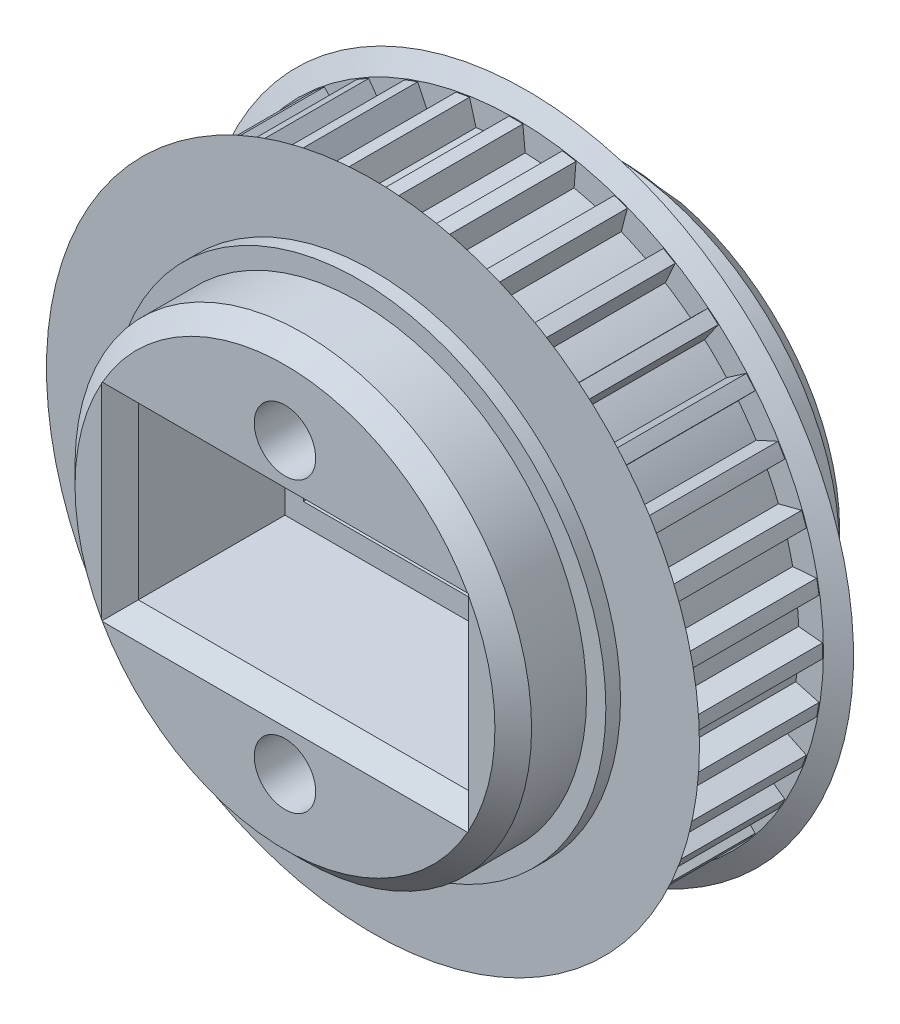
from build123d import *
from build123d.topology import SkipClean

# Parameters (mm, degrees)
CROQUIS1_R                 = 2
SALIENTE_EXTRUIR1_DEPTH    = 7.2
CROQUIS2_R                 = 18.5
CROQUIS2_R_2               = 2
SALIENTE_EXTRUIR2_DEPTH    = 0.6
SALIENTE_EXTRUIR4_START    = 6.2
CROQUIS4_R                 = 12.45
CROQUIS4_R_2               = 2
SALIENTE_EXTRUIR4_DEPTH    = 6.2
SALIENTE_EXTRUIR6_START    = 0.6
CROQUIS6_R                 = 18.5
CROQUIS6_R_2               = 2
SALIENTE_EXTRUIR6_DEPTH    = 0.6
SALIENTE_EXTRUIR5_START    = 0.6
CROQUIS5_R                 = 13.5
CROQUIS5_R_2               = 2
SALIENTE_EXTRUIR5_DEPTH    = 0.6
CHAFL_N2_SIZE              = 1.732050808
CHAFL_N2_SIZE_2            = 1
CROQUIS3_R                 = 12.45
CROQUIS3_R_2               = 2
SALIENTE_EXTRUIR7_DEPTH    = 4.8
CHAFL_N4_SIZE              = 1
CROQUIS7_R                 = 13.5
CROQUIS7_R_2               = 2
SALIENTE_EXTRUIR8_DEPTH    = 0.8
CORTAR_EXTRUIR1_DEPTH      = 29.159390904
CORTAR_EXTRUIR1_DEPTH_BACK = 29.159390904
CROQUIS8_R                 = 1.675
CROQUIS8_W                 = 16
CROQUIS8_H                 = 7
CORTAR_EXTRUIR2_DEPTH      = 5.5
REDONDEO1_R                = 2.5
CROQUIS10_W                = 18
CROQUIS10_H                = 9.3
CORTAR_EXTRUIR3_DEPTH      = 9
CHAFL_N5_SIZE              = 1


with BuildPart() as part:
    # Croquis1 → Saliente-Extruir1 (new body)
    with BuildSketch(Plane.XY):
        with BuildLine():
            Line((-0.375, 16.714216942), (-0.5, 15.410313844))
            ThreePointArc((-0.5, 15.410313844), (-1.343804123, 15.359751406), (-2.18356904, 15.263020639))
            Line((-2.18356904, 15.263020639), (-2.533090406, 16.525408497))
            ThreePointArc((-2.533090406, 16.525408497), (-2.903123715, 16.464432747), (-3.271696221, 16.395172363))
            Line((-3.271696221, 16.395172363), (-3.168376793, 15.089372461))
            ThreePointArc((-3.168376793, 15.089372461), (-3.99058156, 14.893053132), (-4.800791439, 14.651968275))
            Line((-4.800791439, 14.651968275), (-5.364214141, 15.834483876))
            ThreePointArc((-5.364214141, 15.834483876), (-5.718037486, 15.710178876), (-6.068983607, 15.577968769))
            Line((-6.068983607, 15.577968769), (-5.74048406, 14.309948132))
            ThreePointArc((-5.74048406, 14.309948132), (-6.516107195, 13.973836975), (-7.27214422, 13.595723269))
            Line((-7.27214422, 13.595723269), (-8.032348945, 14.662436476))
            ThreePointArc((-8.032348945, 14.662436476), (-8.35921158, 14.478579169), (-8.681867997, 14.287436476))
            Line((-8.681867997, 14.287436476), (-8.138169624, 13.095723269))
            ThreePointArc((-8.138169624, 13.095723269), (-8.843644211, 12.630032852), (-9.522536579, 12.126379092))
            Line((-9.522536579, 12.126379092), (-10.45642489, 13.044878363))
            ThreePointArc((-10.45642489, 13.044878363), (-10.746395261, 12.80705516), (-11.030958222, 12.562787656))
            Line((-11.030958222, 12.562787656), (-10.288581022, 11.483591482))
            ThreePointArc((-10.288581022, 11.483591482), (-10.902471572, 10.902471572), (-11.483591482, 10.288581022))
            Line((-11.483591482, 10.288581022), (-12.562787656, 11.030958222))
            ThreePointArc((-12.562787656, 11.030958222), (-12.80705516, 10.746395261), (-13.044878363, 10.45642489))
            Line((-13.044878363, 10.45642489), (-12.126379092, 9.522536579))
            ThreePointArc((-12.126379092, 9.522536579), (-12.630032852, 8.843644211), (-13.095723269, 8.138169624))
            Line((-13.095723269, 8.138169624), (-14.287436476, 8.681867997))
            ThreePointArc((-14.287436476, 8.681867997), (-14.478579169, 8.35921158), (-14.662436476, 8.032348945))
            Line((-14.662436476, 8.032348945), (-13.595723269, 7.27214422))
            ThreePointArc((-13.595723269, 7.27214422), (-13.973836975, 6.516107195), (-14.309948132, 5.74048406))
            Line((-14.309948132, 5.74048406), (-15.577968769, 6.068983607))
            ThreePointArc((-15.577968769, 6.068983607), (-15.710178876, 5.718037486), (-15.834483876, 5.364214141))
            Line((-15.834483876, 5.364214141), (-14.651968275, 4.800791439))
            ThreePointArc((-14.651968275, 4.800791439), (-14.893053132, 3.99058156), (-15.089372461, 3.168376793))
            Line((-15.089372461, 3.168376793), (-16.395172363, 3.271696221))
            ThreePointArc((-16.395172363, 3.271696221), (-16.464432747, 2.903123715), (-16.525408497, 2.533090406))
            Line((-16.525408497, 2.533090406), (-15.263020639, 2.18356904))
            ThreePointArc((-15.263020639, 2.18356904), (-15.359751406, 1.343804123), (-15.410313844, 0.5))
            Line((-15.410313844, 0.5), (-16.714216942, 0.375))
            ThreePointArc((-16.714216942, 0.375), (-16.718423161, 0), (-16.714216942, -0.375))
            Line((-16.714216942, -0.375), (-15.410313844, -0.5))
            ThreePointArc((-15.410313844, -0.5), (-15.359751406, -1.343804123), (-15.263020639, -2.18356904))
            Line((-15.263020639, -2.18356904), (-16.525408497, -2.533090406))
            ThreePointArc((-16.525408497, -2.533090406), (-16.464432747, -2.903123715), (-16.395172363, -3.271696221))
            Line((-16.395172363, -3.271696221), (-15.089372461, -3.168376793))
            ThreePointArc((-15.089372461, -3.168376793), (-14.893053132, -3.99058156), (-14.651968275, -4.800791439))
            Line((-14.651968275, -4.800791439), (-15.834483876, -5.364214141))
            ThreePointArc((-15.834483876, -5.364214141), (-15.710178876, -5.718037486), (-15.577968769, -6.068983607))
            Line((-15.577968769, -6.068983607), (-14.309948132, -5.74048406))
            ThreePointArc((-14.309948132, -5.74048406), (-13.973836975, -6.516107195), (-13.595723269, -7.27214422))
            Line((-13.595723269, -7.27214422), (-14.662436476, -8.032348945))
            ThreePointArc((-14.662436476, -8.032348945), (-14.478579169, -8.35921158), (-14.287436476, -8.681867997))
            Line((-14.287436476, -8.681867997), (-13.095723269, -8.138169624))
            ThreePointArc((-13.095723269, -8.138169624), (-12.630032852, -8.843644211), (-12.126379092, -9.522536579))
            Line((-12.126379092, -9.522536579), (-13.044878363, -10.45642489))
            ThreePointArc((-13.044878363, -10.45642489), (-12.80705516, -10.746395261), (-12.562787656, -11.030958222))
            Line((-12.562787656, -11.030958222), (-11.483591482, -10.288581022))
            ThreePointArc((-11.483591482, -10.288581022), (-10.902471572, -10.902471572), (-10.288581022, -11.483591482))
            Line((-10.288581022, -11.483591482), (-11.030958222, -12.562787656))
            ThreePointArc((-11.030958222, -12.562787656), (-10.746395261, -12.80705516), (-10.45642489, -13.044878363))
            Line((-10.45642489, -13.044878363), (-9.522536579, -12.126379092))
            ThreePointArc((-9.522536579, -12.126379092), (-8.843644211, -12.630032852), (-8.138169624, -13.095723269))
            Line((-8.138169624, -13.095723269), (-8.681867997, -14.287436476))
            ThreePointArc((-8.681867997, -14.287436476), (-8.35921158, -14.478579169), (-8.032348945, -14.662436476))
            Line((-8.032348945, -14.662436476), (-7.27214422, -13.595723269))
            ThreePointArc((-7.27214422, -13.595723269), (-6.516107195, -13.973836975), (-5.74048406, -14.309948132))
            Line((-5.74048406, -14.309948132), (-6.068983607, -15.577968769))
            ThreePointArc((-6.068983607, -15.577968769), (-5.718037486, -15.710178876), (-5.364214141, -15.834483876))
            Line((-5.364214141, -15.834483876), (-4.800791439, -14.651968275))
            ThreePointArc((-4.800791439, -14.651968275), (-3.99058156, -14.893053132), (-3.168376793, -15.089372461))
            Line((-3.168376793, -15.089372461), (-3.271696221, -16.395172363))
            ThreePointArc((-3.271696221, -16.395172363), (-2.903123715, -16.464432747), (-2.533090406, -16.525408497))
            Line((-2.533090406, -16.525408497), (-2.18356904, -15.263020639))
            ThreePointArc((-2.18356904, -15.263020639), (-1.343804123, -15.359751406), (-0.5, -15.410313844))
            Line((-0.5, -15.410313844), (-0.375, -16.714216942))
            ThreePointArc((-0.375, -16.714216942), (0, -16.718423161), (0.375, -16.714216942))
            Line((0.375, -16.714216942), (0.5, -15.410313844))
            ThreePointArc((0.5, -15.410313844), (1.343804123, -15.359751406), (2.18356904, -15.263020639))
            Line((2.18356904, -15.263020639), (2.533090406, -16.525408497))
            ThreePointArc((2.533090406, -16.525408497), (2.903123715, -16.464432747), (3.271696221, -16.395172363))
            Line((3.271696221, -16.395172363), (3.168376793, -15.089372461))
            ThreePointArc((3.168376793, -15.089372461), (3.99058156, -14.893053132), (4.800791439, -14.651968275))
            Line((4.800791439, -14.651968275), (5.364214141, -15.834483876))
            ThreePointArc((5.364214141, -15.834483876), (5.718037486, -15.710178876), (6.068983607, -15.577968769))
            Line((6.068983607, -15.577968769), (5.74048406, -14.309948132))
            ThreePointArc((5.74048406, -14.309948132), (6.516107195, -13.973836975), (7.27214422, -13.595723269))
            Line((7.27214422, -13.595723269), (8.032348945, -14.662436476))
            ThreePointArc((8.032348945, -14.662436476), (8.35921158, -14.478579169), (8.681867997, -14.287436476))
            Line((8.681867997, -14.287436476), (8.138169624, -13.095723269))
            ThreePointArc((8.138169624, -13.095723269), (8.843644211, -12.630032852), (9.522536579, -12.126379092))
            Line((9.522536579, -12.126379092), (10.45642489, -13.044878363))
            ThreePointArc((10.45642489, -13.044878363), (10.746395261, -12.80705516), (11.030958222, -12.562787656))
            Line((11.030958222, -12.562787656), (10.288581022, -11.483591482))
            ThreePointArc((10.288581022, -11.483591482), (10.902471572, -10.902471572), (11.483591482, -10.288581022))
            Line((11.483591482, -10.288581022), (12.562787656, -11.030958222))
            ThreePointArc((12.562787656, -11.030958222), (12.80705516, -10.746395261), (13.044878363, -10.45642489))
            Line((13.044878363, -10.45642489), (12.126379092, -9.522536579))
            ThreePointArc((12.126379092, -9.522536579), (12.630032852, -8.843644211), (13.095723269, -8.138169624))
            Line((13.095723269, -8.138169624), (14.287436476, -8.681867997))
            ThreePointArc((14.287436476, -8.681867997), (14.478579169, -8.35921158), (14.662436476, -8.032348945))
            Line((14.662436476, -8.032348945), (13.595723269, -7.27214422))
            ThreePointArc((13.595723269, -7.27214422), (13.973836975, -6.516107195), (14.309948132, -5.74048406))
            Line((14.309948132, -5.74048406), (15.577968769, -6.068983607))
            ThreePointArc((15.577968769, -6.068983607), (15.710178876, -5.718037486), (15.834483876, -5.364214141))
            Line((15.834483876, -5.364214141), (14.651968275, -4.800791439))
            ThreePointArc((14.651968275, -4.800791439), (14.893053132, -3.99058156), (15.089372461, -3.168376793))
            Line((15.089372461, -3.168376793), (16.395172363, -3.271696221))
            ThreePointArc((16.395172363, -3.271696221), (16.464432747, -2.903123715), (16.525408497, -2.533090406))
            Line((16.525408497, -2.533090406), (15.263020639, -2.18356904))
            ThreePointArc((15.263020639, -2.18356904), (15.359751406, -1.343804123), (15.410313844, -0.5))
            Line((15.410313844, -0.5), (16.714216942, -0.375))
            ThreePointArc((16.714216942, -0.375), (16.718423161, 0), (16.714216942, 0.375))
            Line((16.714216942, 0.375), (15.410313844, 0.5))
            ThreePointArc((15.410313844, 0.5), (15.359751406, 1.343804123), (15.263020639, 2.18356904))
            Line((15.263020639, 2.18356904), (16.525408497, 2.533090406))
            ThreePointArc((16.525408497, 2.533090406), (16.464432747, 2.903123715), (16.395172363, 3.271696221))
            Line((16.395172363, 3.271696221), (15.089372461, 3.168376793))
            ThreePointArc((15.089372461, 3.168376793), (14.893053132, 3.99058156), (14.651968275, 4.800791439))
            Line((14.651968275, 4.800791439), (15.834483876, 5.364214141))
            ThreePointArc((15.834483876, 5.364214141), (15.710178876, 5.718037486), (15.577968769, 6.068983607))
            Line((15.577968769, 6.068983607), (14.309948132, 5.74048406))
            ThreePointArc((14.309948132, 5.74048406), (13.973836975, 6.516107195), (13.595723269, 7.27214422))
            Line((13.595723269, 7.27214422), (14.662436476, 8.032348945))
            ThreePointArc((14.662436476, 8.032348945), (14.478579169, 8.35921158), (14.287436476, 8.681867997))
            Line((14.287436476, 8.681867997), (13.095723269, 8.138169624))
            ThreePointArc((13.095723269, 8.138169624), (12.630032852, 8.843644211), (12.126379092, 9.522536579))
            Line((12.126379092, 9.522536579), (13.044878363, 10.45642489))
            ThreePointArc((13.044878363, 10.45642489), (12.80705516, 10.746395261), (12.562787656, 11.030958222))
            Line((12.562787656, 11.030958222), (11.483591482, 10.288581022))
            ThreePointArc((11.483591482, 10.288581022), (10.902471572, 10.902471572), (10.288581022, 11.483591482))
            Line((10.288581022, 11.483591482), (11.030958222, 12.562787656))
            ThreePointArc((11.030958222, 12.562787656), (10.746395261, 12.80705516), (10.45642489, 13.044878363))
            Line((10.45642489, 13.044878363), (9.522536579, 12.126379092))
            ThreePointArc((9.522536579, 12.126379092), (8.843644211, 12.630032852), (8.138169624, 13.095723269))
            Line((8.138169624, 13.095723269), (8.681867997, 14.287436476))
            ThreePointArc((8.681867997, 14.287436476), (8.35921158, 14.478579169), (8.032348945, 14.662436476))
            Line((8.032348945, 14.662436476), (7.27214422, 13.595723269))
            ThreePointArc((7.27214422, 13.595723269), (6.516107195, 13.973836975), (5.74048406, 14.309948132))
            Line((5.74048406, 14.309948132), (6.068983607, 15.577968769))
            ThreePointArc((6.068983607, 15.577968769), (5.718037486, 15.710178876), (5.364214141, 15.834483876))
            Line((5.364214141, 15.834483876), (4.800791439, 14.651968275))
            ThreePointArc((4.800791439, 14.651968275), (3.99058156, 14.893053132), (3.168376793, 15.089372461))
            Line((3.168376793, 15.089372461), (3.271696221, 16.395172363))
            ThreePointArc((3.271696221, 16.395172363), (2.903123715, 16.464432747), (2.533090406, 16.525408497))
            Line((2.533090406, 16.525408497), (2.18356904, 15.263020639))
            ThreePointArc((2.18356904, 15.263020639), (1.343804123, 15.359751406), (0.5, 15.410313844))
            Line((0.5, 15.410313844), (0.375, 16.714216942))
            ThreePointArc((0.375, 16.714216942), (0, 16.718423161), (-0.375, 16.714216942))
        make_face()
        Circle(CROQUIS1_R, mode=Mode.SUBTRACT)
    extrude(amount=SALIENTE_EXTRUIR1_DEPTH)

    # Croquis2 → Saliente-Extruir2 (add)
    with BuildSketch(Plane.XY.offset(7.2)):
        Circle(CROQUIS2_R)
        Circle(CROQUIS2_R_2, mode=Mode.SUBTRACT)
    extrude(amount=SALIENTE_EXTRUIR2_DEPTH)

    # Croquis4 → Saliente-Extruir4 (add)
    with BuildSketch(Plane(origin=(0, 0, 0), x_dir=(-1, 0, 0), z_dir=(0, 0, -1)).offset(SALIENTE_EXTRUIR4_START)):
        with Locations(Location((0, 0, 0), (0, 0, 180))):
            Circle(CROQUIS4_R)
        Circle(CROQUIS4_R_2, mode=Mode.SUBTRACT)
    extrude(amount=-SALIENTE_EXTRUIR4_DEPTH)

    # Croquis6 → Saliente-Extruir6 (add)
    with SkipClean():  # the faces are left unmerged after this step: merging them gives an invalid solid
        with BuildSketch(Plane(origin=(0, 0, 0), x_dir=(-1, 0, 0), z_dir=(0, 0, -1)).offset(SALIENTE_EXTRUIR6_START)):
            with Locations(Location((0, 0, 0), (0, 0, 180))):
                Circle(CROQUIS6_R)
            Circle(CROQUIS6_R_2, mode=Mode.SUBTRACT)
        extrude(amount=-SALIENTE_EXTRUIR6_DEPTH)

    # Croquis5 → Saliente-Extruir5 (add)
    with SkipClean():  # the faces are left unmerged after this step: merging them gives an invalid solid
        with BuildSketch(Plane(origin=(0, 0, -0.6), x_dir=(-1, 0, 0), z_dir=(0, 0, -1)).offset(SALIENTE_EXTRUIR5_START)):
            Circle(CROQUIS5_R)
            Circle(CROQUIS5_R_2, mode=Mode.SUBTRACT)
        extrude(amount=-SALIENTE_EXTRUIR5_DEPTH)

    # Chaflán2
    # the kernel refuses this chamfer: 1.732050808, 1 mm, written as the material it takes off along each edge
    with BuildSketch(Plane(origin=(0, 0, 0), x_dir=(1, 0, 0), z_dir=(0, 1, 0))) as chafl_n2_piece_1:
        Polygon((18.5 - CHAFL_N2_SIZE, 0), (18.5, CHAFL_N2_SIZE_2), (18.5, 0), align=None)
    revolve(axis=Axis((0, 0, 0), (0, 0, -1)), mode=Mode.SUBTRACT)
    with BuildSketch(Plane(origin=(0, 0, 7.2), x_dir=(1, 0, 0), z_dir=(0, -1, 0))) as chafl_n2_piece_2:
        Polygon((18.5 - CHAFL_N2_SIZE, 0), (18.5, CHAFL_N2_SIZE_2), (18.5, 0), align=None)
    revolve(axis=Axis((0, 0, 7.2), (0, 0, 1)), mode=Mode.SUBTRACT)

    # Croquis3 → Saliente-Extruir7 (add)
    with BuildSketch(Plane.XY.offset(7.8)):
        Circle(CROQUIS3_R)
        with Locations(Location((0, 0, 0), (0, 0, 180))):
            Circle(CROQUIS3_R_2, mode=Mode.SUBTRACT)
    extrude(amount=SALIENTE_EXTRUIR7_DEPTH)

    # Chaflán4
    chafl_n4_edges = [part.edges().sort_by_distance(p)[0] for p in [
        (-12.45, 0, -6.2),
        (-12.45, 0, 12.6),
    ]]
    chamfer(chafl_n4_edges, length=CHAFL_N4_SIZE)

    # Croquis7 → Saliente-Extruir8 (add)
    with BuildSketch(Plane.XY.offset(7.8)):
        with Locations(Location((0, 0, 0), (0, 0, 180))):
            Circle(CROQUIS7_R)
        with Locations(Location((0, 0, 0), (0, 0, 180))):
            Circle(CROQUIS7_R_2, mode=Mode.SUBTRACT)
    extrude(amount=SALIENTE_EXTRUIR8_DEPTH)

    # Croquis8 → Cortar-Extruir1 (cut, two sides: drawn at the far end of the back side and taken through both)
    with BuildSketch(Plane.XY.offset(-CORTAR_EXTRUIR1_DEPTH_BACK)):
        with Locations((0, 7.875631857)):
            Circle(CROQUIS8_R)
        with Locations((0, -7.875631857)):
            Circle(CROQUIS8_R)
        Rectangle(CROQUIS8_W, CROQUIS8_H)
    extrude(amount=CORTAR_EXTRUIR1_DEPTH + CORTAR_EXTRUIR1_DEPTH_BACK, mode=Mode.SUBTRACT)

    # Croquis9 → Cortar-Extruir2 (cut)
    with BuildSketch(Plane(origin=(0, 0, -6.2), x_dir=(-1, 0, 0), z_dir=(0, 0, -1))):
        Polygon((2.33826859, 3.825631857), (4.67653718, 7.875631857), (2.33826859, 11.925631857), (-2.33826859, 11.925631857), (-4.67653718, 7.875631857), (-2.33826859, 3.825631857), align=None)
        Polygon((2.33826859, -11.925631857), (4.67653718, -7.875631857), (2.33826859, -3.825631857), (-2.33826859, -3.825631857), (-4.67653718, -7.875631857), (-2.33826859, -11.925631857), align=None)
    extrude(amount=-CORTAR_EXTRUIR2_DEPTH, mode=Mode.SUBTRACT)

    # Redondeo1
    redondeo1_edges = [part.edges().sort_by_distance(p)[0] for p in [
        (0, 3.825631857, -0.7),
        (3.507402885, 5.850631857, -0.7),
        (3.507402885, 9.900631857, -0.7),
        (0, 11.925631857, -0.7),
        (-3.507402885, 9.900631857, -0.7),
        (-3.507402885, 5.850631857, -0.7),
        (0, -11.925631857, -0.7),
        (3.507402885, -9.900631857, -0.7),
        (3.507402885, -5.850631857, -0.7),
        (0, -3.825631857, -0.7),
        (-3.507402885, -5.850631857, -0.7),
        (-3.507402885, -9.900631857, -0.7),
    ]]
    fillet(redondeo1_edges, radius=REDONDEO1_R)

    # Croquis10 → Cortar-Extruir3 (cut)
    with BuildSketch(Plane.XY.offset(12.6)):
        Rectangle(CROQUIS10_W, CROQUIS10_H)
    extrude(amount=-CORTAR_EXTRUIR3_DEPTH, mode=Mode.SUBTRACT)

    # Chaflán5
    # the kernel refuses this chamfer: 1 mm, written as the material it takes off along each edge
    with BuildSketch(Plane(origin=(-8, -3.5, -6.2), x_dir=(-0.9996219169112968, 0, -0.02749587661058651), z_dir=(0, 1, 0)), Plane(origin=(8, 3.5, -6.2), x_dir=(0.9996219169112968, 0, -0.02749587661058651), z_dir=(0, -1, 0))) as chafl_n5_piece_1:
        Polygon((CHAFL_N5_SIZE * 0.999621916911, CHAFL_N5_SIZE * 0.0274958766106), (-CHAFL_N5_SIZE * 0.0274958766106, CHAFL_N5_SIZE * 0.999621916911), (0, 0), align=None)
    extrude(amount=7, mode=Mode.SUBTRACT)
    with BuildSketch(Plane(origin=(-8, 3.5, -6.2), x_dir=(0, 0.9996219169112968, -0.027495876610586487), z_dir=(1, 0, 0)), Plane(origin=(8, -3.5, -6.2), x_dir=(0, -0.9996219169112968, -0.027495876610586497), z_dir=(-1, 0, 0))) as chafl_n5_piece_2:
        Polygon((CHAFL_N5_SIZE * 0.999621916911, CHAFL_N5_SIZE * 0.0274958766106), (-CHAFL_N5_SIZE * 0.0274958766106, CHAFL_N5_SIZE * 0.999621916911), (0, 0), align=None)
    extrude(amount=16, mode=Mode.SUBTRACT)
    with BuildSketch(Plane(origin=(9, -4.65, 12.6), x_dir=(0.9996219169112968, 0, 0.027495876610585647), z_dir=(0, 1, 0)), Plane(origin=(-9, 4.65, 12.6), x_dir=(-0.9996219169112968, 0, 0.027495876610585647), z_dir=(0, -1, 0))) as chafl_n5_piece_3:
        Polygon((CHAFL_N5_SIZE * 0.999621916911, CHAFL_N5_SIZE * 0.0274958766106), (-CHAFL_N5_SIZE * 0.0274958766106, CHAFL_N5_SIZE * 0.999621916911), (0, 0), align=None)
    extrude(amount=9.3, mode=Mode.SUBTRACT)
    with BuildSketch(Plane(origin=(9, 4.65, 12.6), x_dir=(0, 0.9996219169112968, 0.027495876610585623), z_dir=(-1, 0, 0)), Plane(origin=(-9, -4.65, 12.6), x_dir=(0, -0.9996219169112968, 0.027495876610585623), z_dir=(1, 0, 0))) as chafl_n5_piece_4:
        Polygon((CHAFL_N5_SIZE * 0.999621916911, CHAFL_N5_SIZE * 0.0274958766106), (-CHAFL_N5_SIZE * 0.0274958766106, CHAFL_N5_SIZE * 0.999621916911), (0, 0), align=None)
    extrude(amount=18, mode=Mode.SUBTRACT)
    with BuildSketch(Plane(origin=(-8, -6.071682988, -6.2), x_dir=(-0.9996219169112968, 0, -0.02749587661058651), z_dir=(0, 1, 0))) as chafl_n5_piece_5a_section:
        Polygon((CHAFL_N5_SIZE * 0.999621916911, CHAFL_N5_SIZE * 0.0274958766106), (-CHAFL_N5_SIZE * 0.0274958766106, CHAFL_N5_SIZE * 0.999621916911), (0, 0), align=None)
    chafl_n5_piece_5a = extrude(amount=9.571682988, mode=Mode.PRIVATE)
    chafl_n5_piece_5a = split(chafl_n5_piece_5a, bisect_by=Plane(origin=(-8.329793627, -3.5, -5.870206373), z_dir=(0, -1, 0)), keep=Keep.TOP, mode=Mode.PRIVATE)
    with BuildSketch(Plane(origin=(8, -3.5, -6.2), x_dir=(0, -0.9996219169112968, -0.027495876610586497), z_dir=(-1, 0, 0))) as chafl_n5_piece_5b_section:
        Polygon((CHAFL_N5_SIZE * 0.999621916911, CHAFL_N5_SIZE * 0.0274958766106), (-CHAFL_N5_SIZE * 0.0274958766106, CHAFL_N5_SIZE * 0.999621916911), (0, 0), align=None)
    chafl_n5_piece_5b = extrude(amount=18.571682988, mode=Mode.PRIVATE)
    chafl_n5_piece_5b = split(chafl_n5_piece_5b, bisect_by=Plane(origin=(-8, -3.829793627, -5.870206373), z_dir=(-1, 0, 0)), keep=Keep.TOP, mode=Mode.PRIVATE)
    chafl_n5_piece_5 = chafl_n5_piece_5a & chafl_n5_piece_5b
    add(chafl_n5_piece_5, mode=Mode.SUBTRACT)
    with BuildSketch(Plane(origin=(-10.571682988, 3.5, -6.2), x_dir=(0, 0.9996219169112968, -0.027495876610586487), z_dir=(1, 0, 0))) as chafl_n5_piece_6a_section:
        Polygon((CHAFL_N5_SIZE * 0.999621916911, CHAFL_N5_SIZE * 0.0274958766106), (-CHAFL_N5_SIZE * 0.0274958766106, CHAFL_N5_SIZE * 0.999621916911), (0, 0), align=None)
    chafl_n5_piece_6a = extrude(amount=18.571682988, mode=Mode.PRIVATE)
    chafl_n5_piece_6a = split(chafl_n5_piece_6a, bisect_by=Plane(origin=(-8, 3.829793627, -5.870206373), z_dir=(-1, 0, 0)), keep=Keep.TOP, mode=Mode.PRIVATE)
    with BuildSketch(Plane(origin=(-8, -3.5, -6.2), x_dir=(-0.9996219169112968, 0, -0.02749587661058651), z_dir=(0, 1, 0))) as chafl_n5_piece_6b_section:
        Polygon((CHAFL_N5_SIZE * 0.999621916911, CHAFL_N5_SIZE * 0.0274958766106), (-CHAFL_N5_SIZE * 0.0274958766106, CHAFL_N5_SIZE * 0.999621916911), (0, 0), align=None)
    chafl_n5_piece_6b = extrude(amount=9.571682988, mode=Mode.PRIVATE)
    chafl_n5_piece_6b = split(chafl_n5_piece_6b, bisect_by=Plane(origin=(-8.329793627, 3.5, -5.870206373), z_dir=(0, 1, 0)), keep=Keep.TOP, mode=Mode.PRIVATE)
    chafl_n5_piece_6 = chafl_n5_piece_6a & chafl_n5_piece_6b
    add(chafl_n5_piece_6, mode=Mode.SUBTRACT)
    with BuildSketch(Plane(origin=(-8, 3.5, -6.2), x_dir=(0, 0.9996219169112968, -0.027495876610586487), z_dir=(1, 0, 0))) as chafl_n5_piece_7a_section:
        Polygon((CHAFL_N5_SIZE * 0.999621916911, CHAFL_N5_SIZE * 0.0274958766106), (-CHAFL_N5_SIZE * 0.0274958766106, CHAFL_N5_SIZE * 0.999621916911), (0, 0), align=None)
    chafl_n5_piece_7a = extrude(amount=18.571682988, mode=Mode.PRIVATE)
    chafl_n5_piece_7a = split(chafl_n5_piece_7a, bisect_by=Plane(origin=(8, 3.829793627, -5.870206373), z_dir=(1, 0, 0)), keep=Keep.TOP, mode=Mode.PRIVATE)
    with BuildSketch(Plane(origin=(8, 6.071682988, -6.2), x_dir=(0.9996219169112968, 0, -0.02749587661058651), z_dir=(0, -1, 0))) as chafl_n5_piece_7b_section:
        Polygon((CHAFL_N5_SIZE * 0.999621916911, CHAFL_N5_SIZE * 0.0274958766106), (-CHAFL_N5_SIZE * 0.0274958766106, CHAFL_N5_SIZE * 0.999621916911), (0, 0), align=None)
    chafl_n5_piece_7b = extrude(amount=9.571682988, mode=Mode.PRIVATE)
    chafl_n5_piece_7b = split(chafl_n5_piece_7b, bisect_by=Plane(origin=(8.329793627, 3.5, -5.870206373), z_dir=(0, 1, 0)), keep=Keep.TOP, mode=Mode.PRIVATE)
    chafl_n5_piece_7 = chafl_n5_piece_7a & chafl_n5_piece_7b
    add(chafl_n5_piece_7, mode=Mode.SUBTRACT)
    with BuildSketch(Plane(origin=(8, 3.5, -6.2), x_dir=(0.9996219169112968, 0, -0.02749587661058651), z_dir=(0, -1, 0))) as chafl_n5_piece_8a_section:
        Polygon((CHAFL_N5_SIZE * 0.999621916911, CHAFL_N5_SIZE * 0.0274958766106), (-CHAFL_N5_SIZE * 0.0274958766106, CHAFL_N5_SIZE * 0.999621916911), (0, 0), align=None)
    chafl_n5_piece_8a = extrude(amount=9.571682988, mode=Mode.PRIVATE)
    chafl_n5_piece_8a = split(chafl_n5_piece_8a, bisect_by=Plane(origin=(8.329793627, -3.5, -5.870206373), z_dir=(0, -1, 0)), keep=Keep.TOP, mode=Mode.PRIVATE)
    with BuildSketch(Plane(origin=(10.571682988, -3.5, -6.2), x_dir=(0, -0.9996219169112968, -0.027495876610586497), z_dir=(-1, 0, 0))) as chafl_n5_piece_8b_section:
        Polygon((CHAFL_N5_SIZE * 0.999621916911, CHAFL_N5_SIZE * 0.0274958766106), (-CHAFL_N5_SIZE * 0.0274958766106, CHAFL_N5_SIZE * 0.999621916911), (0, 0), align=None)
    chafl_n5_piece_8b = extrude(amount=18.571682988, mode=Mode.PRIVATE)
    chafl_n5_piece_8b = split(chafl_n5_piece_8b, bisect_by=Plane(origin=(8, -3.829793627, -5.870206373), z_dir=(1, 0, 0)), keep=Keep.TOP, mode=Mode.PRIVATE)
    chafl_n5_piece_8 = chafl_n5_piece_8a & chafl_n5_piece_8b
    add(chafl_n5_piece_8, mode=Mode.SUBTRACT)
    with BuildSketch(Plane(origin=(-9, -4.65, 12.6), x_dir=(0, -0.9996219169112968, 0.027495876610585623), z_dir=(1, 0, 0))) as chafl_n5_piece_9a_section:
        Polygon((CHAFL_N5_SIZE * 0.999621916911, CHAFL_N5_SIZE * 0.0274958766106), (-CHAFL_N5_SIZE * 0.0274958766106, CHAFL_N5_SIZE * 0.999621916911), (0, 0), align=None)
    chafl_n5_piece_9a = extrude(amount=20.571682988, mode=Mode.PRIVATE)
    chafl_n5_piece_9a = split(chafl_n5_piece_9a, bisect_by=Plane(origin=(9, -4.979793627, 12.270206373), z_dir=(1, 0, 0)), keep=Keep.TOP, mode=Mode.PRIVATE)
    with BuildSketch(Plane(origin=(9, -7.221682988, 12.6), x_dir=(0.9996219169112968, 0, 0.027495876610585647), z_dir=(0, 1, 0))) as chafl_n5_piece_9b_section:
        Polygon((CHAFL_N5_SIZE * 0.999621916911, CHAFL_N5_SIZE * 0.0274958766106), (-CHAFL_N5_SIZE * 0.0274958766106, CHAFL_N5_SIZE * 0.999621916911), (0, 0), align=None)
    chafl_n5_piece_9b = extrude(amount=11.871682988, mode=Mode.PRIVATE)
    chafl_n5_piece_9b = split(chafl_n5_piece_9b, bisect_by=Plane(origin=(9.329793627, -4.65, 12.270206373), z_dir=(0, -1, 0)), keep=Keep.TOP, mode=Mode.PRIVATE)
    chafl_n5_piece_9 = chafl_n5_piece_9a & chafl_n5_piece_9b
    add(chafl_n5_piece_9, mode=Mode.SUBTRACT)
    with BuildSketch(Plane(origin=(11.571682988, 4.65, 12.6), x_dir=(0, 0.9996219169112968, 0.027495876610585623), z_dir=(-1, 0, 0))) as chafl_n5_piece_10a_section:
        Polygon((CHAFL_N5_SIZE * 0.999621916911, CHAFL_N5_SIZE * 0.0274958766106), (-CHAFL_N5_SIZE * 0.0274958766106, CHAFL_N5_SIZE * 0.999621916911), (0, 0), align=None)
    chafl_n5_piece_10a = extrude(amount=20.571682988, mode=Mode.PRIVATE)
    chafl_n5_piece_10a = split(chafl_n5_piece_10a, bisect_by=Plane(origin=(9, 4.979793627, 12.270206373), z_dir=(1, 0, 0)), keep=Keep.TOP, mode=Mode.PRIVATE)
    with BuildSketch(Plane(origin=(9, -4.65, 12.6), x_dir=(0.9996219169112968, 0, 0.027495876610585647), z_dir=(0, 1, 0))) as chafl_n5_piece_10b_section:
        Polygon((CHAFL_N5_SIZE * 0.999621916911, CHAFL_N5_SIZE * 0.0274958766106), (-CHAFL_N5_SIZE * 0.0274958766106, CHAFL_N5_SIZE * 0.999621916911), (0, 0), align=None)
    chafl_n5_piece_10b = extrude(amount=11.871682988, mode=Mode.PRIVATE)
    chafl_n5_piece_10b = split(chafl_n5_piece_10b, bisect_by=Plane(origin=(9.329793627, 4.65, 12.270206373), z_dir=(0, 1, 0)), keep=Keep.TOP, mode=Mode.PRIVATE)
    chafl_n5_piece_10 = chafl_n5_piece_10a & chafl_n5_piece_10b
    add(chafl_n5_piece_10, mode=Mode.SUBTRACT)
    with BuildSketch(Plane(origin=(9, 4.65, 12.6), x_dir=(0, 0.9996219169112968, 0.027495876610585623), z_dir=(-1, 0, 0))) as chafl_n5_piece_11a_section:
        Polygon((CHAFL_N5_SIZE * 0.999621916911, CHAFL_N5_SIZE * 0.0274958766106), (-CHAFL_N5_SIZE * 0.0274958766106, CHAFL_N5_SIZE * 0.999621916911), (0, 0), align=None)
    chafl_n5_piece_11a = extrude(amount=20.571682988, mode=Mode.PRIVATE)
    chafl_n5_piece_11a = split(chafl_n5_piece_11a, bisect_by=Plane(origin=(-9, 4.979793627, 12.270206373), z_dir=(-1, 0, 0)), keep=Keep.TOP, mode=Mode.PRIVATE)
    with BuildSketch(Plane(origin=(-9, 7.221682988, 12.6), x_dir=(-0.9996219169112968, 0, 0.027495876610585647), z_dir=(0, -1, 0))) as chafl_n5_piece_11b_section:
        Polygon((CHAFL_N5_SIZE * 0.999621916911, CHAFL_N5_SIZE * 0.0274958766106), (-CHAFL_N5_SIZE * 0.0274958766106, CHAFL_N5_SIZE * 0.999621916911), (0, 0), align=None)
    chafl_n5_piece_11b = extrude(amount=11.871682988, mode=Mode.PRIVATE)
    chafl_n5_piece_11b = split(chafl_n5_piece_11b, bisect_by=Plane(origin=(-9.329793627, 4.65, 12.270206373), z_dir=(0, 1, 0)), keep=Keep.TOP, mode=Mode.PRIVATE)
    chafl_n5_piece_11 = chafl_n5_piece_11a & chafl_n5_piece_11b
    add(chafl_n5_piece_11, mode=Mode.SUBTRACT)
    with BuildSketch(Plane(origin=(-9, 4.65, 12.6), x_dir=(-0.9996219169112968, 0, 0.027495876610585647), z_dir=(0, -1, 0))) as chafl_n5_piece_12a_section:
        Polygon((CHAFL_N5_SIZE * 0.999621916911, CHAFL_N5_SIZE * 0.0274958766106), (-CHAFL_N5_SIZE * 0.0274958766106, CHAFL_N5_SIZE * 0.999621916911), (0, 0), align=None)
    chafl_n5_piece_12a = extrude(amount=11.871682988, mode=Mode.PRIVATE)
    chafl_n5_piece_12a = split(chafl_n5_piece_12a, bisect_by=Plane(origin=(-9.329793627, -4.65, 12.270206373), z_dir=(0, -1, 0)), keep=Keep.TOP, mode=Mode.PRIVATE)
    with BuildSketch(Plane(origin=(-11.571682988, -4.65, 12.6), x_dir=(0, -0.9996219169112968, 0.027495876610585623), z_dir=(1, 0, 0))) as chafl_n5_piece_12b_section:
        Polygon((CHAFL_N5_SIZE * 0.999621916911, CHAFL_N5_SIZE * 0.0274958766106), (-CHAFL_N5_SIZE * 0.0274958766106, CHAFL_N5_SIZE * 0.999621916911), (0, 0), align=None)
    chafl_n5_piece_12b = extrude(amount=20.571682988, mode=Mode.PRIVATE)
    chafl_n5_piece_12b = split(chafl_n5_piece_12b, bisect_by=Plane(origin=(-9, -4.979793627, 12.270206373), z_dir=(-1, 0, 0)), keep=Keep.TOP, mode=Mode.PRIVATE)
    chafl_n5_piece_12 = chafl_n5_piece_12a & chafl_n5_piece_12b
    add(chafl_n5_piece_12, mode=Mode.SUBTRACT)


solid = part.part
